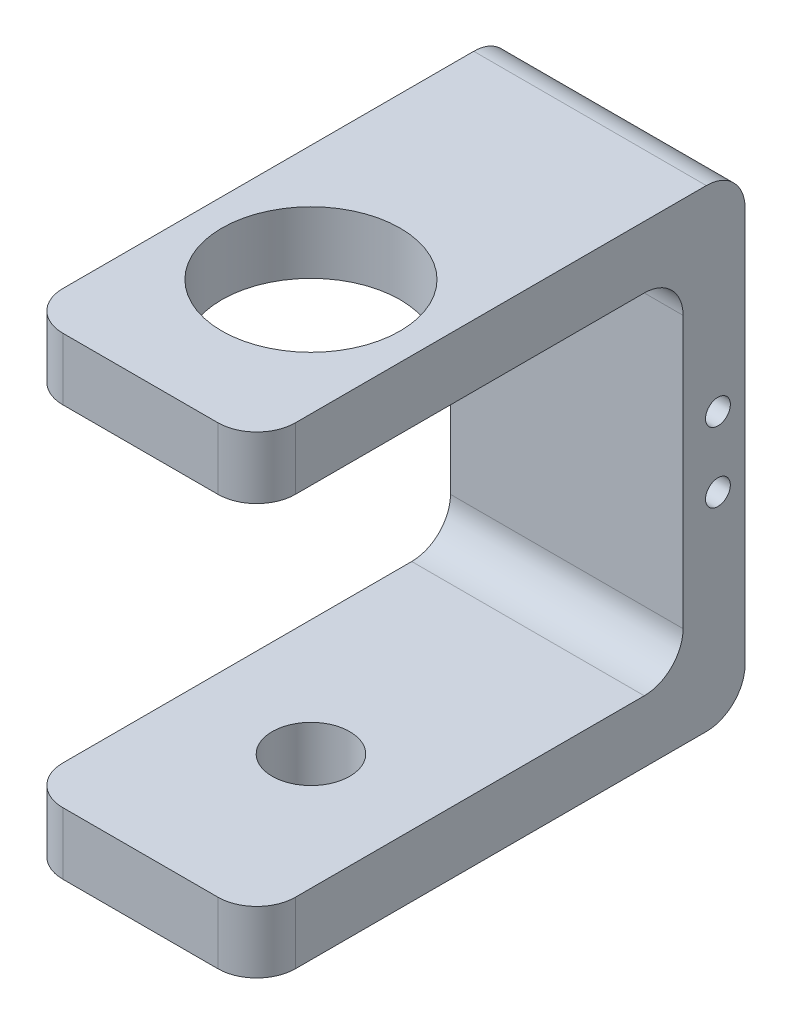
from build123d import *

# Parameters (mm, degrees)
BOSS_EXTRUDE1_DEPTH = 30
CUT_EXTRUDE1_REACH  = 94.682
SKETCH2_R           = 11.5
CUT_EXTRUDE2_REACH  = 89.624
SKETCH3_R           = 5
CUT_EXTRUDE3_REACH  = 89.624
SKETCH4_R           = 1.6
FILLET1_R           = 5
FILLET2_R           = 5


with BuildPart() as part:
    # Sketch1 → Boss-Extrude1 (new body)
    with BuildSketch(Plane(origin=(0, 0, 0), x_dir=(0, 0, -1), z_dir=(1, 0, 0))):
        Polygon((0, 0), (55, 0), (55, -45), (0, -45), (0, -53), (63, -53), (63, 8), (0, 8), align=None)
    extrude(amount=BOSS_EXTRUDE1_DEPTH)

    # Sketch2 → Cut-Extrude1 (cut, up to next)
    with BuildSketch(Plane(origin=(0, 8, 0), x_dir=(1, 0, 0), z_dir=(0, 1, 0)), mode=Mode.PRIVATE) as cut_extrude1_sk1:
        with Locations((15, 22)):
            Circle(SKETCH2_R)
    cut_extrude1_tool1 = extrude(cut_extrude1_sk1.sketch, amount=-CUT_EXTRUDE1_REACH, mode=Mode.PRIVATE) & part.part
    add(cut_extrude1_tool1.solids().sort_by_distance((15, 8, -22))[0], mode=Mode.SUBTRACT)

    # Sketch3 → Cut-Extrude2 (cut, up to next)
    with BuildSketch(Plane(origin=(0, -45, 0), x_dir=(1, 0, 0), z_dir=(0, 1, 0)), mode=Mode.PRIVATE) as cut_extrude2_sk1:
        with Locations((15, 22)):
            Circle(SKETCH3_R)
    cut_extrude2_tool1 = extrude(cut_extrude2_sk1.sketch, amount=-CUT_EXTRUDE2_REACH, mode=Mode.PRIVATE) & part.part
    add(cut_extrude2_tool1.solids().sort_by_distance((15, -45, -22))[0], mode=Mode.SUBTRACT)

    # Sketch4 → Cut-Extrude3 (cut, up to next)
    with BuildSketch(Plane(origin=(30, 0, 0), x_dir=(0, 0, -1), z_dir=(1, 0, 0)), mode=Mode.PRIVATE) as cut_extrude3_sk1:
        with Locations((59.5, -27)):
            Circle(SKETCH4_R)
    cut_extrude3_tool1 = extrude(cut_extrude3_sk1.sketch, amount=-CUT_EXTRUDE3_REACH, mode=Mode.PRIVATE) & part.part
    # Sketch4 → Cut-Extrude3 (cut, up to next)
    with BuildSketch(Plane(origin=(30, 0, 0), x_dir=(0, 0, -1), z_dir=(1, 0, 0)), mode=Mode.PRIVATE) as cut_extrude3_sk2:
        with Locations((59.5, -18)):
            Circle(SKETCH4_R)
    cut_extrude3_tool2 = extrude(cut_extrude3_sk2.sketch, amount=-CUT_EXTRUDE3_REACH, mode=Mode.PRIVATE) & part.part
    add(cut_extrude3_tool1.solids().sort_by_distance((30, -27, -59.5))[0], mode=Mode.SUBTRACT)
    add(cut_extrude3_tool2.solids().sort_by_distance((30, -18, -59.5))[0], mode=Mode.SUBTRACT)

    # Fillet1
    fillet1_edges = [part.edges().sort_by_distance(p)[0] for p in [
        (15, -53, -63),
        (15, 8, -63),
        (0, -49, 0),
        (0, 4, 0),
        (30, -49, 0),
        (30, 4, 0),
    ]]
    fillet(fillet1_edges, radius=FILLET1_R)

    # Fillet2
    fillet2_edges = [part.edges().sort_by_distance(p)[0] for p in [
        (15, 0, -55),
        (15, -45, -55),
    ]]
    fillet(fillet2_edges, radius=FILLET2_R)


solid = part.part
